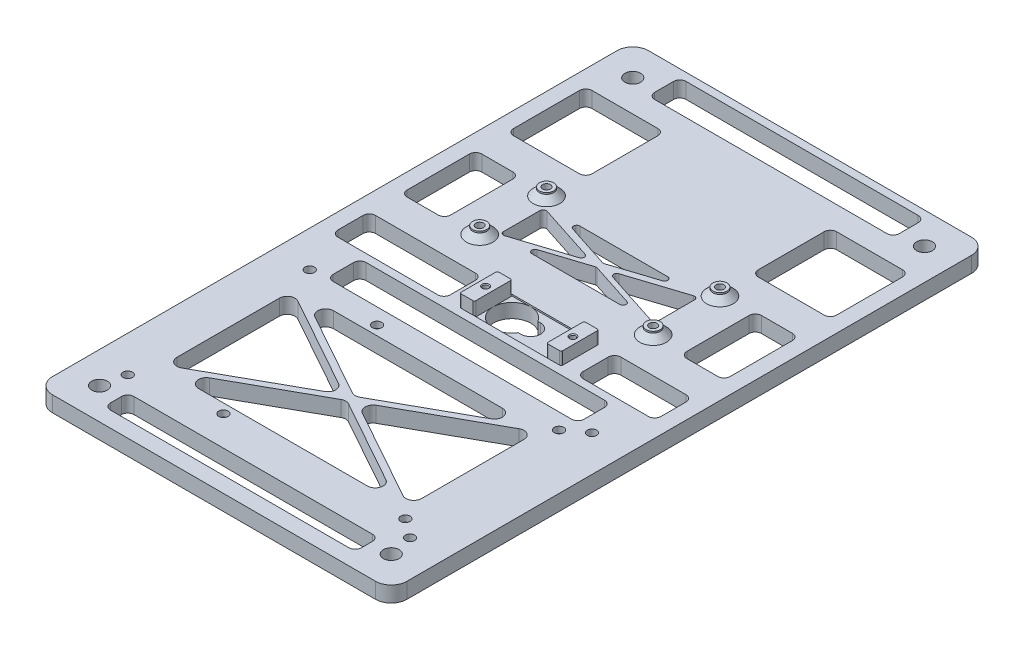
from build123d import *

# Parameters (mm, degrees)
SKETCH1_W           = 113
SKETCH1_H           = 190
SKETCH1_R           = 2.5
BOSS_EXTRUDE1_DEPTH = 5
FILLET1_R           = 5
SKETCH2_R           = 1.5
CUT_EXTRUDE1_DEPTH  = 10
SKETCH3_R           = 1.5
CUT_EXTRUDE2_DEPTH  = 10
CUT_EXTRUDE4_DEPTH  = 10
CUT_EXTRUDE16_DEPTH = 111.644701635
SKETCH22_W          = 23
SKETCH22_H          = 12
CUT_EXTRUDE17_DEPTH = 0.5
SKETCH23_W          = 4.675
SKETCH23_H          = 12
SKETCH23_R          = 0.875
BOSS_EXTRUDE5_DEPTH = 4
CUT_EXTRUDE18_START = -1.5
SKETCH24_R          = 0.875
CUT_EXTRUDE18_DEPTH = 1.5
SKETCH12_W          = 25
SKETCH12_H          = 25
CUT_EXTRUDE9_DEPTH  = 111.644701635
CUT_EXTRUDE11_REACH = 112.645
SKETCH15_W          = 35.825
SKETCH15_H          = 12
SKETCH15_W_2        = 24.825
FILLET3_R           = 2
CUT_EXTRUDE12_REACH = 112.897
SKETCH16_R          = 1.25
CUT_EXTRUDE13_REACH = 112.645
CUT_EXTRUDE14_DEPTH = 111.644701635
SKETCH19_R          = 2.25
SKETCH19_R_2        = 1.25
BOSS_EXTRUDE4_DEPTH = 2.5
CHAMFER1_SIZE       = 2
SKETCH20_R          = 2.5
CUT_EXTRUDE15_DEPTH = 3
FILLET4_R           = 0.5
CHAMFER2_SIZE       = 0.25


with BuildPart() as part:
    # Sketch1 → Boss-Extrude1 (new body)
    with BuildSketch(Plane(origin=(0, 0, 0), x_dir=(1, 0, 0), z_dir=(0, 1, 0))):
        Rectangle(SKETCH1_W, SKETCH1_H)
        with Locations((46.5, 85)):
            Circle(SKETCH1_R, mode=Mode.SUBTRACT)
        with Locations((-46.5, 85)):
            Circle(SKETCH1_R, mode=Mode.SUBTRACT)
        with Locations((-46.5, -85)):
            Circle(SKETCH1_R, mode=Mode.SUBTRACT)
        with Locations((46.5, -85)):
            Circle(SKETCH1_R, mode=Mode.SUBTRACT)
    extrude(amount=BOSS_EXTRUDE1_DEPTH)

    # Fillet1
    fillet1_edges = [part.edges().sort_by_distance(p)[0] for p in [
        (-56.5, 2.5, 95),
        (-56.5, 2.5, -95),
        (56.5, 2.5, -95),
        (56.5, 2.5, 95),
    ]]
    fillet(fillet1_edges, radius=FILLET1_R)

    # Sketch2 → Cut-Extrude1 (cut)
    with BuildSketch(Plane(origin=(0, 5, 0), x_dir=(1, 0, 0), z_dir=(0, 1, 0))):
        with Locations((39, -24)):
            Circle(SKETCH2_R)
        with Locations((39, -73)):
            Circle(SKETCH2_R)
        with Locations((-19, -24)):
            Circle(SKETCH2_R)
        with Locations((-19, -73)):
            Circle(SKETCH2_R)
    extrude(amount=-CUT_EXTRUDE1_DEPTH, mode=Mode.SUBTRACT)

    # Sketch3 → Cut-Extrude2 (cut)
    with BuildSketch(Plane(origin=(0, 5, 0), x_dir=(1, 0, 0), z_dir=(0, 1, 0))):
        with Locations((45, -19.5)):
            Circle(SKETCH3_R)
        with Locations((45, -77.5)):
            Circle(SKETCH3_R)
        with Locations((-45, -19.5)):
            Circle(SKETCH3_R)
        with Locations((-45, -77.5)):
            Circle(SKETCH3_R)
    extrude(amount=-CUT_EXTRUDE2_DEPTH, mode=Mode.SUBTRACT)

    # Sketch5 → Cut-Extrude4 (cut)
    with BuildSketch(Plane(origin=(0, 5, 0), x_dir=(1, 0, 0), z_dir=(0, 1, 0))):
        with BuildLine():
            Line((-38, -90), (38, -90))
            ThreePointArc((38, -90), (39.414213562, -89.414213562), (40, -88))
            Line((40, -88), (40, -84.5))
            ThreePointArc((40, -84.5), (39.414213562, -83.085786438), (38, -82.5))
            Line((38, -82.5), (-38, -82.5))
            ThreePointArc((-38, -82.5), (-39.414213562, -83.085786438), (-40, -84.5))
            Line((-40, -84.5), (-40, -88))
            ThreePointArc((-40, -88), (-39.414213562, -89.414213562), (-38, -90))
        make_face()
    extrude(amount=-CUT_EXTRUDE4_DEPTH, mode=Mode.SUBTRACT)

    # Sketch21 → Cut-Extrude16 (cut, through all)
    with BuildSketch(Plane(origin=(0, 5, 0), x_dir=(1, 0, 0), z_dir=(0, 1, 0))):
        with BuildLine():
            Line((5.975, -3.125), (5.121950312, -3.125))
            ThreePointArc((5.121950312, -3.125), (-6, 0), (5.121950312, 3.125))
            Line((5.121950312, 3.125), (5.975, 3.125))
            ThreePointArc((5.975, 3.125), (9.1, 0), (5.975, -3.125))
        make_face()
    extrude(amount=-CUT_EXTRUDE16_DEPTH, mode=Mode.SUBTRACT)

    # Sketch22 → Cut-Extrude17 (cut)
    with BuildSketch(Plane(origin=(0, 5, 0), x_dir=(1, 0, 0), z_dir=(0, 1, 0))):
        with Locations((5.5, 0)):
            Rectangle(SKETCH22_W, SKETCH22_H)
    extrude(amount=-CUT_EXTRUDE17_DEPTH, mode=Mode.SUBTRACT)

    # Sketch23 → Boss-Extrude5 (add)
    # profile 1 of 2: a face of its own
    with BuildSketch(Plane(origin=(0, 5, 0), x_dir=(1, 0, 0), z_dir=(0, 1, 0))):
        with Locations((-8.3375, 0)):
            Rectangle(SKETCH23_W, SKETCH23_H)
        with Locations((-8.4, 0)):
            Circle(SKETCH23_R, mode=Mode.SUBTRACT)
    # profile 2 of 2: a face of its own
    with BuildSketch(Plane(origin=(0, 5, 0), x_dir=(1, 0, 0), z_dir=(0, 1, 0))):
        with Locations((19.3375, 0)):
            Rectangle(SKETCH23_W, SKETCH23_H)
        with Locations((19.4, 0)):
            Circle(SKETCH23_R, mode=Mode.SUBTRACT)
    extrude(amount=BOSS_EXTRUDE5_DEPTH)

    # Sketch24 → Cut-Extrude18 (cut)
    with BuildSketch(Plane(origin=(0, 5, 0), x_dir=(1, 0, 0), z_dir=(0, 1, 0)).offset(CUT_EXTRUDE18_START)):
        with Locations((19.4, 0)):
            Circle(SKETCH24_R)
        with Locations((-8.4, 0)):
            Circle(SKETCH24_R)
    extrude(amount=CUT_EXTRUDE18_DEPTH, mode=Mode.SUBTRACT)

    # Sketch12 → Cut-Extrude9 (cut, through all)
    with BuildSketch(Plane(origin=(0, 5, 0), x_dir=(1, 0, 0), z_dir=(0, 1, 0))):
        with Locations((-39, 62.5)):
            Rectangle(SKETCH12_W, SKETCH12_H)
        with Locations((39, 62.5)):
            Rectangle(SKETCH12_W, SKETCH12_H)
    extrude(amount=-CUT_EXTRUDE9_DEPTH, mode=Mode.SUBTRACT)

    # Sketch15 → Cut-Extrude11 (cut, up to next)
    with BuildSketch(Plane(origin=(0, 5, 0), x_dir=(1, 0, 0), z_dir=(0, 1, 0)), mode=Mode.PRIVATE) as cut_extrude11_sk1:
        with Locations((-33.5875, 0)):
            Rectangle(SKETCH15_W, SKETCH15_H)
    cut_extrude11_tool1 = extrude(cut_extrude11_sk1.sketch, amount=-CUT_EXTRUDE11_REACH, mode=Mode.PRIVATE) & part.part
    # Sketch15 → Cut-Extrude11 (cut, up to next)
    with BuildSketch(Plane(origin=(0, 5, 0), x_dir=(1, 0, 0), z_dir=(0, 1, 0)), mode=Mode.PRIVATE) as cut_extrude11_sk2:
        with Locations((39.0875, 0)):
            Rectangle(SKETCH15_W_2, SKETCH15_H)
    cut_extrude11_tool2 = extrude(cut_extrude11_sk2.sketch, amount=-CUT_EXTRUDE11_REACH, mode=Mode.PRIVATE) & part.part
    add(cut_extrude11_tool1.solids().sort_by_distance((-33.5875, 5, 0))[0], mode=Mode.SUBTRACT)
    add(cut_extrude11_tool2.solids().sort_by_distance((39.0875, 5, 0))[0], mode=Mode.SUBTRACT)

    # Fillet3
    fillet3_edges = [part.edges().sort_by_distance(p)[0] for p in [
        (-51.5, 2.5, 6),
        (-51.5, 2.5, -6),
        (-15.675, 2.5, -6),
        (-15.675, 2.5, 6),
        (51.5, 2.5, -6),
        (26.675, 2.5, -6),
        (26.675, 2.5, 6),
        (51.5, 2.5, 6),
        (51.5, 2.5, -50),
        (51.5, 2.5, -75),
        (26.5, 2.5, -50),
        (26.5, 2.5, -75),
        (-26.5, 2.5, -50),
        (-51.5, 2.5, -50),
        (-51.5, 2.5, -75),
        (-26.5, 2.5, -75),
    ]]
    fillet(fillet3_edges, radius=FILLET3_R)

    # Sketch16 → Cut-Extrude12 (cut, up to next)
    with BuildSketch(Plane.XZ, mode=Mode.PRIVATE) as cut_extrude12_sk1:
        with Locations((-27.65, -17.35)):
            Circle(SKETCH16_R)
    cut_extrude12_tool1 = extrude(cut_extrude12_sk1.sketch, amount=-CUT_EXTRUDE12_REACH, mode=Mode.PRIVATE) & part.part
    # Sketch16 → Cut-Extrude12 (cut, up to next)
    with BuildSketch(Plane.XZ, mode=Mode.PRIVATE) as cut_extrude12_sk2:
        with Locations((27.65, -17.35)):
            Circle(SKETCH16_R)
    cut_extrude12_tool2 = extrude(cut_extrude12_sk2.sketch, amount=-CUT_EXTRUDE12_REACH, mode=Mode.PRIVATE) & part.part
    # Sketch16 → Cut-Extrude12 (cut, up to next)
    with BuildSketch(Plane.XZ, mode=Mode.PRIVATE) as cut_extrude12_sk3:
        with Locations((27.65, -38.65)):
            Circle(SKETCH16_R)
    cut_extrude12_tool3 = extrude(cut_extrude12_sk3.sketch, amount=-CUT_EXTRUDE12_REACH, mode=Mode.PRIVATE) & part.part
    # Sketch16 → Cut-Extrude12 (cut, up to next)
    with BuildSketch(Plane.XZ, mode=Mode.PRIVATE) as cut_extrude12_sk4:
        with Locations((-27.65, -38.65)):
            Circle(SKETCH16_R)
    cut_extrude12_tool4 = extrude(cut_extrude12_sk4.sketch, amount=-CUT_EXTRUDE12_REACH, mode=Mode.PRIVATE) & part.part
    # Sketch16 → Cut-Extrude12 (cut, up to next)
    with BuildSketch(Plane.XZ, mode=Mode.PRIVATE) as cut_extrude12_sk5:
        with BuildLine():
            Line((-42, 64.8228648), (-42, 32.1771352))
            ThreePointArc((-42, 32.1771352), (-40.766661958, 30.021777345), (-38.283546013, 29.993047359))
            Line((-38.283546013, 29.993047359), (-8.976584213, 46.315912159))
            ThreePointArc((-8.976584213, 46.315912159), (-7.6930382, 48.5), (-8.976584213, 50.684087841))
            Line((-8.976584213, 50.684087841), (-38.283546013, 67.006952641))
            ThreePointArc((-38.283546013, 67.006952641), (-40.766661958, 66.978222655), (-42, 64.8228648))
        make_face()
    cut_extrude12_tool5 = extrude(cut_extrude12_sk5.sketch, amount=-CUT_EXTRUDE12_REACH, mode=Mode.PRIVATE) & part.part
    # Sketch16 → Cut-Extrude12 (cut, up to next)
    with BuildSketch(Plane.XZ, mode=Mode.PRIVATE) as cut_extrude12_sk6:
        with BuildLine():
            Line((-31.13705215, 31.684087841), (-4.216453987, 46.677838717))
            ThreePointArc((-4.216453987, 46.677838717), (-3, 46.993750876), (-1.783546013, 46.677838717))
            Line((-1.783546013, 46.677838717), (25.13705215, 31.684087841))
            ThreePointArc((25.13705215, 31.684087841), (26.340331578, 28.871597105), (23.920598163, 27))
            Line((23.920598163, 27), (-29.920598163, 27))
            ThreePointArc((-29.920598163, 27), (-32.340331578, 28.871597105), (-31.13705215, 31.684087841))
        make_face()
    cut_extrude12_tool6 = extrude(cut_extrude12_sk6.sketch, amount=-CUT_EXTRUDE12_REACH, mode=Mode.PRIVATE) & part.part
    # Sketch16 → Cut-Extrude12 (cut, up to next)
    with BuildSketch(Plane.XZ, mode=Mode.PRIVATE) as cut_extrude12_sk7:
        with BuildLine():
            Line((32.283546013, 29.993047359), (2.976584213, 46.315912159))
            ThreePointArc((2.976584213, 46.315912159), (1.6930382, 48.5), (2.976584213, 50.684087841))
            Line((2.976584213, 50.684087841), (32.283546013, 67.006952641))
            ThreePointArc((32.283546013, 67.006952641), (34.766661958, 66.978222655), (36, 64.8228648))
            Line((36, 64.8228648), (36, 32.1771352))
            ThreePointArc((36, 32.1771352), (34.766661958, 30.021777345), (32.283546013, 29.993047359))
        make_face()
    cut_extrude12_tool7 = extrude(cut_extrude12_sk7.sketch, amount=-CUT_EXTRUDE12_REACH, mode=Mode.PRIVATE) & part.part
    # Sketch16 → Cut-Extrude12 (cut, up to next)
    with BuildSketch(Plane.XZ, mode=Mode.PRIVATE) as cut_extrude12_sk8:
        with BuildLine():
            Line((-1.783546013, 50.322161283), (25.13705215, 65.315912159))
            ThreePointArc((25.13705215, 65.315912159), (26.340331578, 68.128402895), (23.920598163, 70))
            Line((23.920598163, 70), (-29.920598163, 70))
            ThreePointArc((-29.920598163, 70), (-32.340331578, 68.128402895), (-31.13705215, 65.315912159))
            Line((-31.13705215, 65.315912159), (-4.216453987, 50.322161283))
            ThreePointArc((-4.216453987, 50.322161283), (-3, 50.006249124), (-1.783546013, 50.322161283))
        make_face()
    cut_extrude12_tool8 = extrude(cut_extrude12_sk8.sketch, amount=-CUT_EXTRUDE12_REACH, mode=Mode.PRIVATE) & part.part
    # Sketch16 → Cut-Extrude12 (cut, up to next)
    with BuildSketch(Plane.XZ, mode=Mode.PRIVATE) as cut_extrude12_sk9:
        with BuildLine():
            Line((-37, -82.5), (37, -82.5))
            ThreePointArc((37, -82.5), (38.414213562, -83.085786438), (39, -84.5))
            Line((39, -84.5), (39, -90.5))
            ThreePointArc((39, -90.5), (38.414213562, -91.914213562), (37, -92.5))
            Line((37, -92.5), (-37, -92.5))
            ThreePointArc((-37, -92.5), (-38.414213562, -91.914213562), (-39, -90.5))
            Line((-39, -90.5), (-39, -84.5))
            ThreePointArc((-39, -84.5), (-38.414213562, -83.085786438), (-37, -82.5))
        make_face()
    cut_extrude12_tool9 = extrude(cut_extrude12_sk9.sketch, amount=-CUT_EXTRUDE12_REACH, mode=Mode.PRIVATE) & part.part
    add(cut_extrude12_tool1.solids().sort_by_distance((-27.65, 0, -17.35))[0], mode=Mode.SUBTRACT)
    add(cut_extrude12_tool2.solids().sort_by_distance((27.65, 0, -17.35))[0], mode=Mode.SUBTRACT)
    add(cut_extrude12_tool3.solids().sort_by_distance((27.65, 0, -38.65))[0], mode=Mode.SUBTRACT)
    add(cut_extrude12_tool4.solids().sort_by_distance((-27.65, 0, -38.65))[0], mode=Mode.SUBTRACT)
    add(cut_extrude12_tool5.solids().sort_by_distance((-29.697812, 0, 48.5))[0], mode=Mode.SUBTRACT)
    add(cut_extrude12_tool6.solids().sort_by_distance((-3, 0, 34.022847))[0], mode=Mode.SUBTRACT)
    add(cut_extrude12_tool7.solids().sort_by_distance((23.697812, 0, 48.5))[0], mode=Mode.SUBTRACT)
    add(cut_extrude12_tool8.solids().sort_by_distance((-3, 0, 62.977153))[0], mode=Mode.SUBTRACT)
    add(cut_extrude12_tool9.solids().sort_by_distance((0, 0, -87.5))[0], mode=Mode.SUBTRACT)

    # Sketch17 → Cut-Extrude13 (cut, up to next)
    with BuildSketch(Plane(origin=(0, 5, 0), x_dir=(1, 0, 0), z_dir=(0, 1, 0)), mode=Mode.PRIVATE) as cut_extrude13_sk1:
        with BuildLine():
            Line((-39.65, 39.9), (-49.5, 39.9))
            ThreePointArc((-49.5, 39.9), (-50.914213562, 39.314213562), (-51.5, 37.9))
            Line((-51.5, 37.9), (-51.5, 18.1))
            ThreePointArc((-51.5, 18.1), (-50.914213562, 16.685786438), (-49.5, 16.1))
            Line((-49.5, 16.1), (-39.65, 16.1))
            ThreePointArc((-39.65, 16.1), (-38.235786438, 16.685786438), (-37.65, 18.1))
            Line((-37.65, 18.1), (-37.65, 37.9))
            ThreePointArc((-37.65, 37.9), (-38.235786438, 39.314213562), (-39.65, 39.9))
        make_face()
    cut_extrude13_tool1 = extrude(cut_extrude13_sk1.sketch, amount=-CUT_EXTRUDE13_REACH, mode=Mode.PRIVATE) & part.part
    # Sketch17 → Cut-Extrude13 (cut, up to next)
    with BuildSketch(Plane(origin=(0, 5, 0), x_dir=(1, 0, 0), z_dir=(0, 1, 0)), mode=Mode.PRIVATE) as cut_extrude13_sk2:
        with BuildLine():
            Line((39.65, 16.1), (49.5, 16.1))
            ThreePointArc((49.5, 16.1), (50.914213562, 16.685786438), (51.5, 18.1))
            Line((51.5, 18.1), (51.5, 37.9))
            ThreePointArc((51.5, 37.9), (50.914213562, 39.314213562), (49.5, 39.9))
            Line((49.5, 39.9), (39.65, 39.9))
            ThreePointArc((39.65, 39.9), (38.235786438, 39.314213562), (37.65, 37.9))
            Line((37.65, 37.9), (37.65, 18.1))
            ThreePointArc((37.65, 18.1), (38.235786438, 16.685786438), (39.65, 16.1))
        make_face()
    cut_extrude13_tool2 = extrude(cut_extrude13_sk2.sketch, amount=-CUT_EXTRUDE13_REACH, mode=Mode.PRIVATE) & part.part
    add(cut_extrude13_tool1.solids().sort_by_distance((-44.575, 5, -28))[0], mode=Mode.SUBTRACT)
    add(cut_extrude13_tool2.solids().sort_by_distance((44.575, 5, -28))[0], mode=Mode.SUBTRACT)

    # Sketch18 → Cut-Extrude14 (cut, through all)
    with BuildSketch(Plane(origin=(0, 5, 0), x_dir=(1, 0, 0), z_dir=(0, 1, 0))):
        with BuildLine():
            Line((-24.65, 33.56152541), (-24.65, 21.912876817))
            ThreePointArc((-24.65, 21.912876817), (-24.23810142, 21.104089627), (-23.341726561, 20.961579026))
            Line((-23.341726561, 20.961579026), (-5.368504959, 26.785903323))
            ThreePointArc((-5.368504959, 26.785903323), (-4.676778398, 27.737201114), (-5.368504959, 28.688498904))
            Line((-5.368504959, 28.688498904), (-23.341726561, 34.512823201))
            ThreePointArc((-23.341726561, 34.512823201), (-24.23810142, 34.370312601), (-24.65, 33.56152541))
        make_face()
        with BuildLine():
            Line((-14.033418904, 35.65), (14.033418904, 35.65))
            ThreePointArc((14.033418904, 35.65), (15.021168313, 34.806048405), (14.341692343, 33.698702209))
            Line((14.341692343, 33.698702209), (0.308273439, 29.1510933))
            ThreePointArc((0.308273439, 29.1510933), (0, 29.102391091), (-0.308273439, 29.1510933))
            Line((-0.308273439, 29.1510933), (-14.341692343, 33.698702209))
            ThreePointArc((-14.341692343, 33.698702209), (-15.021168313, 34.806048405), (-14.033418904, 35.65))
        make_face()
        with BuildLine():
            Line((23.341726561, 20.961579026), (5.368504959, 26.785903323))
            ThreePointArc((5.368504959, 26.785903323), (4.676778398, 27.737201114), (5.368504959, 28.688498904))
            Line((5.368504959, 28.688498904), (23.341726561, 34.512823201))
            ThreePointArc((23.341726561, 34.512823201), (24.23810142, 34.370312601), (24.65, 33.56152541))
            Line((24.65, 33.56152541), (24.65, 21.912876817))
            ThreePointArc((24.65, 21.912876817), (24.23810142, 21.104089627), (23.341726561, 20.961579026))
        make_face()
        with BuildLine():
            Line((14.341692343, 22.301297791), (0.308273439, 26.8489067))
            ThreePointArc((0.308273439, 26.8489067), (0, 26.897608909), (-0.308273439, 26.8489067))
            Line((-0.308273439, 26.8489067), (-14.341692343, 22.301297791))
            ThreePointArc((-14.341692343, 22.301297791), (-15.021168313, 21.193951595), (-14.033418904, 20.35))
            Line((-14.033418904, 20.35), (14.033418904, 20.35))
            ThreePointArc((14.033418904, 20.35), (15.021168313, 21.193951595), (14.341692343, 22.301297791))
        make_face()
        with BuildLine():
            Line((-38, -8.5), (38, -8.5))
            ThreePointArc((38, -8.5), (39.414213562, -9.085786438), (40, -10.5))
            Line((40, -10.5), (40, -17))
            ThreePointArc((40, -17), (39.414213562, -18.414213562), (38, -19))
            Line((38, -19), (-38, -19))
            ThreePointArc((-38, -19), (-39.414213562, -18.414213562), (-40, -17))
            Line((-40, -17), (-40, -10.5))
            ThreePointArc((-40, -10.5), (-39.414213562, -9.085786438), (-38, -8.5))
        make_face()
    extrude(amount=-CUT_EXTRUDE14_DEPTH, mode=Mode.SUBTRACT)

    # Sketch19 → Boss-Extrude4 (add)
    # profile 1 of 4: a face of its own
    with BuildSketch(Plane(origin=(0, 5, 0), x_dir=(1, 0, 0), z_dir=(0, 1, 0))):
        with Locations((-27.65, 38.65)):
            Circle(SKETCH19_R)
        with Locations((-27.65, 38.65)):
            Circle(SKETCH19_R_2, mode=Mode.SUBTRACT)
    # profile 2 of 4: a face of its own
    with BuildSketch(Plane(origin=(0, 5, 0), x_dir=(1, 0, 0), z_dir=(0, 1, 0))):
        with Locations((-27.65, 17.35)):
            Circle(SKETCH19_R)
        with Locations((-27.65, 17.35)):
            Circle(SKETCH19_R_2, mode=Mode.SUBTRACT)
    # profile 3 of 4: a face of its own
    with BuildSketch(Plane(origin=(0, 5, 0), x_dir=(1, 0, 0), z_dir=(0, 1, 0))):
        with Locations((27.65, 38.65)):
            Circle(SKETCH19_R)
        with Locations((27.65, 38.65)):
            Circle(SKETCH19_R_2, mode=Mode.SUBTRACT)
    # profile 4 of 4: a face of its own
    with BuildSketch(Plane(origin=(0, 5, 0), x_dir=(1, 0, 0), z_dir=(0, 1, 0))):
        with Locations((27.65, 17.35)):
            Circle(SKETCH19_R)
        with Locations((27.65, 17.35)):
            Circle(SKETCH19_R_2, mode=Mode.SUBTRACT)
    extrude(amount=BOSS_EXTRUDE4_DEPTH)

    # Chamfer1
    chamfer1_edges = [part.edges().sort_by_distance(p)[0] for p in [
        (-29.9, 5, -38.65),
        (-29.9, 5, -17.35),
        (25.4, 5, -17.35),
        (25.4, 5, -38.65),
    ]]
    chamfer(chamfer1_edges, length=CHAMFER1_SIZE)

    # Sketch20 → Cut-Extrude15 (cut)
    with BuildSketch(Plane.XZ):
        with Locations((-19, 73)):
            Circle(SKETCH20_R)
        with Locations((-19, 24)):
            Circle(SKETCH20_R)
        with Locations((39, 24)):
            Circle(SKETCH20_R)
        with Locations((39, 73)):
            Circle(SKETCH20_R)
    extrude(amount=-CUT_EXTRUDE15_DEPTH, mode=Mode.SUBTRACT)

    # Fillet4
    fillet4_edges = [part.edges().sort_by_distance(p)[0] for p in [
        (21.675, 7, -6),
        (17, 7, -6),
        (-10.675, 7, -6),
        (-6, 7, -6),
        (17, 7, 6),
        (-6, 7, 6),
        (21.675, 7, 6),
        (-10.675, 7, 6),
    ]]
    fillet(fillet4_edges, radius=FILLET4_R)

    # Chamfer2
    chamfer2_edges = [part.edges().sort_by_distance(p)[0] for p in [
        (-9.275, 9, 0),
        (18.525, 9, 0),
    ]]
    chamfer(chamfer2_edges, length=CHAMFER2_SIZE)


solid = part.part
